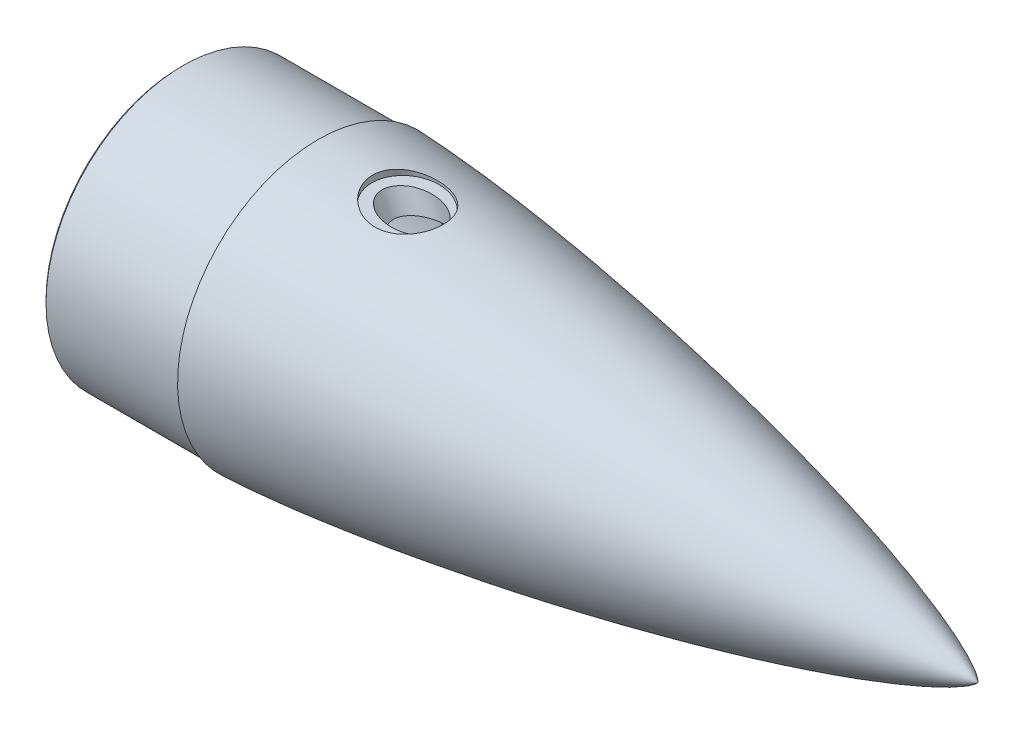
from build123d import *

# Parameters (mm, degrees)
CHAMFER1_SIZE                   = 1.5
TAP_DRILL_FOR_1_HELICOIL1_D     = 6.7564
TAP_DRILL_FOR_1_HELICOIL1_DEPTH = 9.53
CIRPATTERN1_COUNT               = 6
SKETCH26_R                      = 15
CUT_EXTRUDE5_DEPTH              = 50
CUT_EXTRUDE6_START              = 50
SKETCH26_2_R                    = 15
CUT_EXTRUDE6_DEPTH              = 50
SKETCH30_R                      = 22
CUT_EXTRUDE10_DEPTH             = 5


with BuildPart() as part:
    # Sketch10 → Revolve1 (revolve)
    with BuildSketch(Plane.XY):
        with BuildLine():
            Line((11.112493743, 81.99983), (11.112493743, 67.49983))
            Line((11.112493743, 67.49983), (129.304508698, 67.49983))
            add(Edge.make_bspline(
                [(368.967251823, 0), (368.965299543, 0.012338489), (368.959416882, 0.036518378), (368.940636147, 0.082964007), (368.902304552, 0.158736421), (368.845538097, 0.250270687), (368.755690124, 0.376555746), (368.616653262, 0.54835284), (368.392888737, 0.793577299), (368.008659121, 1.164904965), (367.344738263, 1.729853685), (366.176060796, 2.601559154), (364.09282389, 3.960032328), (360.425978756, 6.040734396), (354.402196649, 9.01831007), (344.042994901, 13.507695011), (329.152005398, 19.128483965), (310.425167902, 25.398569259), (288.741266406, 31.933693508), (266.378532845, 38.106125474), (243.901379123, 43.846895186), (221.331994001, 49.212017941), (198.683967629, 54.234500927), (175.966897581, 58.934255644), (156.034567874, 62.771715365), (141.509051931, 65.395628269), (132.679425236, 66.924517444), (129.562757302, 67.455859883), (129.304508698, 67.49983)],
                knots=[0, 0, 0, 0, 0, 0.000134949, 0.000269899, 0.000539798, 0.000919537, 0.001299277, 0.001947431, 0.00293136, 0.004511869, 0.007081312, 0.011380263, 0.018707867, 0.031423867, 0.052705479, 0.084103008, 0.140910136, 0.203703492, 0.266497064, 0.329290816, 0.392084375, 0.454877964, 0.517671564, 0.580465191, 0.643258828, 0.674655593, 0.677492072, 0.677492072, 0.677492072, 0.677492072, 0.677492072], degree=4))
            Line((368.967251823, 0), (408.967251823, 0))
            add(Edge.make_bspline(
                [(408.967251823, 0), (408.964913524, 0.013501739), (408.958040758, 0.039916077), (408.936520441, 0.090485698), (408.892222076, 0.174057132), (408.826281575, 0.275556803), (408.721696416, 0.415833756), (408.561101809, 0.605075245), (408.30561918, 0.87242415), (407.86966713, 1.275299562), (407.120955138, 1.885142115), (405.803773451, 2.82590185), (403.46240692, 4.287152794), (399.325294488, 6.531818454), (392.481146888, 9.758904649), (380.662076725, 14.628008466), (363.637187185, 20.711720382), (342.215241093, 27.476512989), (317.428462321, 34.49762647), (291.879335737, 41.10482439), (266.21046092, 47.228993169), (240.44548836, 52.933436777), (214.598861982, 58.255439009), (188.68089566, 63.217582693), (165.946174917, 67.253280679), (146.421982586, 70.493799722), (130.127893898, 73.044947468), (117.078590637, 74.994157933), (104.015464216, 76.84854079), (92.573263959, 78.384492045), (82.757139441, 79.635603973), (74.571340184, 80.632219902), (68.019260454, 81.400804211), (61.463723364, 82.139375899), (54.90469802, 82.84637726), (48.342159918, 83.519940506), (41.776057559, 84.15778717), (36.02754108, 84.682157239), (31.097921259, 85.105234912), (26.988317923, 85.438669825), (23.699666618, 85.693218594), (20.085807822, 85.958448038), (16.719873821, 86.189018485), (13.602098287, 86.386966779), (10.732704013, 86.554575744), (8.436635008, 86.678703291), (6.139997341, 86.792157585), (4.129892063, 86.879313264), (2.40653858, 86.944618982), (1.257348635, 86.979022496), (0.68269791, 86.99491462), (0.395312527, 86.99983)],
                knots=[0, 0, 0, 0, 0, 0.000130123, 0.000260245, 0.000520491, 0.000900391, 0.00128029, 0.001925099, 0.002881508, 0.004418208, 0.006927086, 0.011110697, 0.018279138, 0.03067276, 0.051704469, 0.08310228, 0.139908797, 0.202702513, 0.265496165, 0.328289682, 0.391083359, 0.453876973, 0.516670577, 0.579464197, 0.642257765, 0.673654596, 0.705051427, 0.736448267, 0.767845106, 0.799241874, 0.814940257, 0.830638641, 0.846337073, 0.862035505, 0.877733936, 0.893432368, 0.90913072, 0.924829072, 0.932678248, 0.940527424, 0.9483766, 0.956225776, 0.967169332, 0.97264111, 0.978112888, 0.983584666, 0.989056444, 0.994528222, 0.997264111, 1, 1, 1, 1, 1], degree=4))
            Line((0.395312527, 86.99983), (0.395312527, 84.99983))
            Line((0.395312527, 84.99983), (-84.604517473, 84.99983))
            Line((-84.604517473, 84.99983), (-84.604517473, 81.99983))
            Line((-84.604517473, 81.99983), (11.112493743, 81.99983))
        make_face()
    revolve(axis=Axis((444.766972073, 0, 0), (-1, 0, 0)))

    # Chamfer1
    chamfer1_edges = [part.edges().sort_by_distance(p)[0] for p in [
        (-84.604517473, -84.99983, 0),
    ]]
    chamfer(chamfer1_edges, length=CHAMFER1_SIZE)

    # Tap Drill for #1 Helicoil1
    with Locations(Plane.ZY.offset(-11.112493743)):
        with Locations((-36.562415, 63.327960427)):
            tap_drill_for_1_helicoil1 = Hole(TAP_DRILL_FOR_1_HELICOIL1_D / 2, depth=TAP_DRILL_FOR_1_HELICOIL1_DEPTH)

    # CirPattern1: Tap Drill for #1 Helicoil1 ×6 about axis
    cirpattern1_axis = Axis((11.112493743, 0, 0), (1, 0, 0))
    for i in range(1, CIRPATTERN1_COUNT):
        add(tap_drill_for_1_helicoil1.rotate(cirpattern1_axis, i * 360 / CIRPATTERN1_COUNT), mode=Mode.SUBTRACT)

    # Sketch26 → Cut-Extrude5 (cut)
    with BuildSketch(Plane(origin=(-27.256378528, 47.209432441, 0), x_dir=(0, 0, 1), z_dir=(-0.500000000000001, 0.866025403784438, 0))):
        with Locations((0, 89.525578438)):
            Circle(SKETCH26_R)
    extrude(amount=-CUT_EXTRUDE5_DEPTH, mode=Mode.SUBTRACT)

    # Sketch26<2> → Cut-Extrude6 (cut)
    with BuildSketch(Plane(origin=(-27.256378528, 47.209432441, 0), x_dir=(0, 0, 1), z_dir=(-0.500000000000001, 0.866025403784438, 0)).offset(CUT_EXTRUDE6_START)):
        with Locations((0, 89.525578438)):
            Circle(SKETCH26_2_R)
    extrude(amount=-CUT_EXTRUDE6_DEPTH, mode=Mode.SUBTRACT)

    # Sketch30 → Cut-Extrude10 (cut)
    with BuildSketch(Plane(origin=(9.253614624, 88.04226205, 0), x_dir=(0, 0, 1), z_dir=(0.10452846326764016, 0.9945218953682747, 0))):
        with Locations((0, 47.151115098)):
            Circle(SKETCH30_R)
    extrude(amount=-CUT_EXTRUDE10_DEPTH, mode=Mode.SUBTRACT)


solid = part.part
